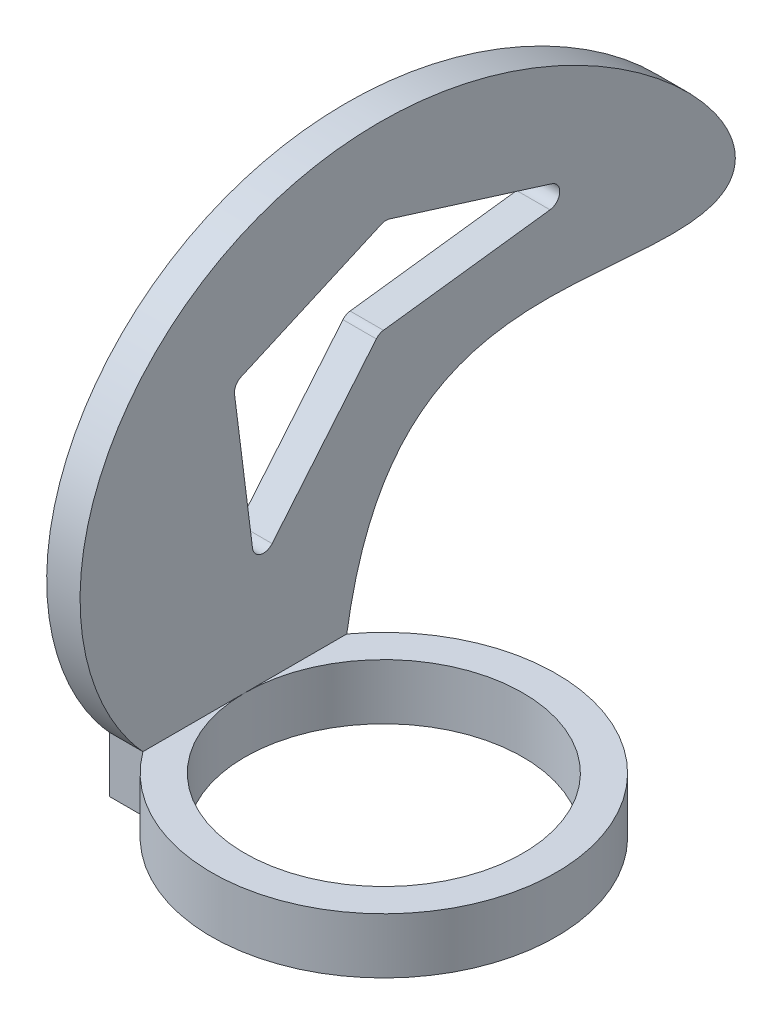
from build123d import *

# Parameters (mm, degrees)
SKETCH1_R           = 7.75
SKETCH1_R_2         = 6.25
BOSS_EXTRUDE1_DEPTH = 2.5
SKETCH2_W           = 1.5
SKETCH2_H           = 37
BOSS_EXTRUDE3_DEPTH = 20
SKETCH3_W           = 1.5
SKETCH3_H           = 9.16515139
BOSS_EXTRUDE4_DEPTH = 2.5
CUT_EXTRUDE1_START  = -1.5
CUT_EXTRUDE1_DEPTH  = 1.5
CUT_EXTRUDE2_DEPTH  = 1.5
FILLET1_R           = 0.5


# Read off the part's stored shape, not the designer's step: Cut-Extrude1
with BuildPart() as part:
    # Sketch1 → Boss-Extrude1 (new body)
    with BuildSketch(Plane(origin=(0, 0, 0), x_dir=(1, 0, 0), z_dir=(0, 1, 0))):
        with Locations(Location((0, 0, 0), (0, 0, 270))):
            Circle(SKETCH1_R)
        with Locations(Location((0, 0, 0), (0, 0, 270))):
            Circle(SKETCH1_R_2, mode=Mode.SUBTRACT)
    extrude(amount=BOSS_EXTRUDE1_DEPTH)

    # Sketch2 → Boss-Extrude3 (add)
    with BuildSketch(Plane(origin=(0, 2.5, 0), x_dir=(1, 0, 0), z_dir=(0, 1, 0))):
        with Locations((-7, 8.5)):
            Rectangle(SKETCH2_W, SKETCH2_H)
    extrude(amount=BOSS_EXTRUDE3_DEPTH)

    # Sketch3 → Boss-Extrude4 (add)
    with BuildSketch(Plane.XZ.offset(-2.5)):
        with Locations((-7, 0)):
            Rectangle(SKETCH3_W, SKETCH3_H)
    extrude(amount=BOSS_EXTRUDE4_DEPTH)

    # Cut-Extrude1 outline → Cut-Extrude1 (cut)
    with BuildSketch(Plane.ZY.offset(7.75).offset(CUT_EXTRUDE1_START)):
        with BuildLine():
            Line((-27, 2.5), (-4.582575695, 2.5))
            add(Edge.make_bspline(
                [(-4.582575695, 2.5), (-5.37555514, 7.388757929), (-8.076108426, 17.923102082), (-16.12020713, 15.261692376), (-31.450561972, -0.033072299), (-33.362744113, 1.044730307), (-22.700260878, 30.26334356), (-4.995418111, 34.118905882), (5.368168563, 20.755950952), (9.611214468, 17.48111109), (9.611214468, 7.985651231), (4.582575695, 2.5)],
                knots=[0, 0, 0, 0, 0, 0, 0, 0, 0, 0, 0, 0, 1, 1, 1, 1, 1, 1, 1, 1, 1, 1, 1, 1], degree=11))
            Line((4.582575695, 2.5), (10, 2.5))
            Line((10, 2.5), (10, 22.5))
            Line((10, 22.5), (-27, 22.5))
            Line((-27, 22.5), (-27, 2.5))
        make_face()
    extrude(amount=CUT_EXTRUDE1_DEPTH, mode=Mode.SUBTRACT)

    # Sketch5 → Cut-Extrude2 (cut)
    with BuildSketch(Plane.ZY.offset(7.75)):
        Polygon((-16.004011086, 14.735802895), (-6.037061634, 13.476408314), (-0.489539097, 6.814092623), (0.511425043, 14.735802895), (-6.318576051, 17.757074741), align=None)
    extrude(amount=-CUT_EXTRUDE2_DEPTH, mode=Mode.SUBTRACT)

    # Fillet1
    fillet1_edges = [part.edges().sort_by_distance(p)[0] for p in [
        (-7, 14.735802895, -16.004011086),
        (-7, 17.757074741, -6.318576051),
        (-7, 14.735802895, 0.511425043),
        (-7, 6.814092623, -0.489539097),
        (-7, 13.476408314, -6.037061634),
    ]]
    fillet(fillet1_edges, radius=FILLET1_R)


solid = part.part
